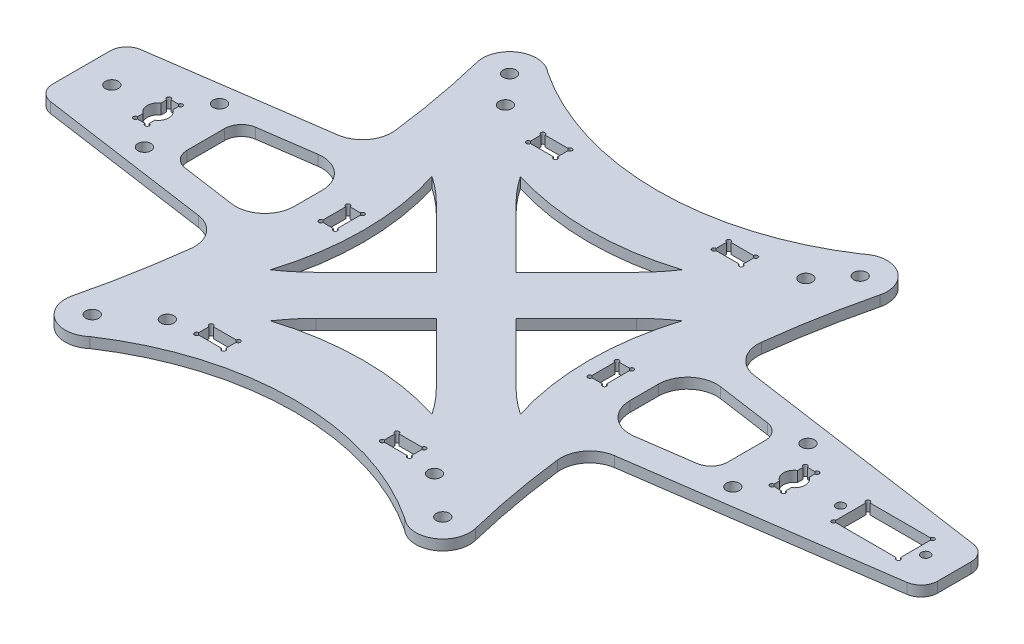
from build123d import *

# Parameters (mm, degrees)
SKETCH_1_R             = 1.55
SKETCH_1_R_2           = 1.05
SKETCH_1_W             = 6.5
SKETCH_1_H             = 3.5
SKETCH_1_W_2           = 3.5
SKETCH_1_H_2           = 6.5
SKETCH_1_W_3           = 15.5
SKETCH_1_H_3           = 8.2
EXTRUDE_1_DEPTH        = 2.5
FILLET_1_R             = 4
FILLET_2_R             = 7
SKETCH_2_R             = 0.5
CUT_EXTRUDE_4968_DEPTH = 128.770204339


with BuildPart() as part:
    # 草图1 → 凸台-拉伸1 (new body)
    with BuildSketch(Plane(origin=(0, 0, 0), x_dir=(1, 0, 0), z_dir=(0, 1, 0))):
        with BuildLine():
            Line((114.591143215, 7.468307572), (114.591143215, -7.468307572))
            Line((114.591143215, -7.468307572), (43.193640968, -17.646273029))
            ThreePointArc((43.193640968, -17.646273029), (45.143245402, -33.15226541), (48.27557779, -48.463217404))
            ThreePointArc((48.27557779, -48.463217404), (45.335063646, -55.533708325), (37.709796983, -54.831018053))
            ThreePointArc((37.709796983, -54.831018053), (0, -43.436211003), (-37.709796983, -54.831018053))
            ThreePointArc((-37.709796983, -54.831018053), (-45.335063646, -55.533708325), (-48.27557779, -48.463217404))
            ThreePointArc((-48.27557779, -48.463217404), (-45.143245402, -33.15226541), (-43.193640968, -17.646273029))
            Line((-43.193640968, -17.646273029), (-94.579518436, -10.321035179))
            Line((-94.579518436, -10.321035179), (-94.579518436, 10.321035179))
            Line((-94.579518436, 10.321035179), (-43.193640968, 17.646273029))
            ThreePointArc((-43.193640968, 17.646273029), (-45.143245402, 33.15226541), (-48.27557779, 48.463217404))
            ThreePointArc((-48.27557779, 48.463217404), (-45.335063646, 55.533708325), (-37.709796983, 54.831018053))
            ThreePointArc((-37.709796983, 54.831018053), (0, 43.436211003), (37.709796983, 54.831018053))
            ThreePointArc((37.709796983, 54.831018053), (45.335063646, 55.533708325), (48.27557779, 48.463217404))
            ThreePointArc((48.27557779, 48.463217404), (45.143245402, 33.15226541), (43.193640968, 17.646273029))
            Line((43.193640968, 17.646273029), (114.591143215, 7.468307572))
        make_face()
        with Locations((-36, 43)):
            Circle(SKETCH_1_R, mode=Mode.SUBTRACT)
        with Locations((-32, -42)):
            Circle(SKETCH_1_R, mode=Mode.SUBTRACT)
        with Locations((32, -42)):
            Circle(SKETCH_1_R, mode=Mode.SUBTRACT)
        with Locations((36, 43)):
            Circle(SKETCH_1_R, mode=Mode.SUBTRACT)
        with Locations((42, 50)):
            Circle(SKETCH_1_R, mode=Mode.SUBTRACT)
        with Locations((42, -50)):
            Circle(SKETCH_1_R, mode=Mode.SUBTRACT)
        with Locations((-42, -50)):
            Circle(SKETCH_1_R, mode=Mode.SUBTRACT)
        with Locations((-42, 50)):
            Circle(SKETCH_1_R, mode=Mode.SUBTRACT)
        with Locations((107.7, 0)):
            Circle(SKETCH_1_R_2, mode=Mode.SUBTRACT)
        with Locations((87.3, 0)):
            Circle(SKETCH_1_R_2, mode=Mode.SUBTRACT)
        with Locations((70.5, 9)):
            Circle(SKETCH_1_R, mode=Mode.SUBTRACT)
        with Locations((70.5, -9)):
            Circle(SKETCH_1_R, mode=Mode.SUBTRACT)
        with Locations((-70.5, -9)):
            Circle(SKETCH_1_R, mode=Mode.SUBTRACT)
        with Locations((-70.5, 9)):
            Circle(SKETCH_1_R, mode=Mode.SUBTRACT)
        with Locations((-87.3, 0)):
            Circle(SKETCH_1_R, mode=Mode.SUBTRACT)
        with Locations((-22.25, 39.75)):
            Rectangle(SKETCH_1_W, SKETCH_1_H, mode=Mode.SUBTRACT)
        with Locations((-32.25, 0)):
            Rectangle(SKETCH_1_W_2, SKETCH_1_H_2, mode=Mode.SUBTRACT)
        with Locations((-22.25, -39.75)):
            Rectangle(SKETCH_1_W, SKETCH_1_H, mode=Mode.SUBTRACT)
        with Locations((22.25, 39.75)):
            Rectangle(SKETCH_1_W, SKETCH_1_H, mode=Mode.SUBTRACT)
        with Locations((22.25, -39.75)):
            Rectangle(SKETCH_1_W, SKETCH_1_H, mode=Mode.SUBTRACT)
        with Locations((32.25, 0)):
            Rectangle(SKETCH_1_W_2, SKETCH_1_H_2, mode=Mode.SUBTRACT)
        with BuildLine():
            Line((77.65, -2.151778405), (77.65, -4))
            Line((77.65, -4), (74.85, -4))
            Line((74.85, -4), (74.85, -2.176778405))
            ThreePointArc((74.85, -2.176778405), (73.652957971, 0), (74.85, 2.176778405))
            Line((74.85, 2.176778405), (74.85, 4))
            Line((74.85, 4), (77.65, 4))
            Line((77.65, 4), (77.65, 2.151778405))
            ThreePointArc((77.65, 2.151778405), (78.8083942, 0), (77.65, -2.151778405))
        make_face(mode=Mode.SUBTRACT)
        with Locations((97.5, 0)):
            Rectangle(SKETCH_1_W_3, SKETCH_1_H_3, mode=Mode.SUBTRACT)
        with BuildLine():
            Line((-74.85, -2.176778405), (-74.85, -4))
            Line((-74.85, -4), (-77.65, -4))
            Line((-77.65, -4), (-77.65, -2.151778405))
            ThreePointArc((-77.65, -2.151778405), (-78.8083942, 0), (-77.65, 2.151778405))
            Line((-77.65, 2.151778405), (-77.65, 4))
            Line((-77.65, 4), (-74.85, 4))
            Line((-74.85, 4), (-74.85, 2.176778405))
            ThreePointArc((-74.85, 2.176778405), (-73.652957971, 0), (-74.85, -2.176778405))
        make_face(mode=Mode.SUBTRACT)
        with BuildLine():
            Line((-23.978041684, 14.429581723), (-9.54845996, 0))
            Line((-9.54845996, 0), (-23.978041684, -14.429581723))
            ThreePointArc((-23.978041684, -14.429581723), (-26.851664039, -17.042325553), (-29.960234119, -19.370614155))
            ThreePointArc((-29.960234119, -19.370614155), (-27.006361348, 0), (-29.960234119, 19.370614155))
            ThreePointArc((-29.960234119, 19.370614155), (-26.851664039, 17.042325553), (-23.978041684, 14.429581723))
        make_face(mode=Mode.SUBTRACT)
        with BuildLine():
            Line((14.429581723, 23.978041684), (0, 9.54845996))
            Line((0, 9.54845996), (-14.429581723, 23.978041684))
            ThreePointArc((-14.429581723, 23.978041684), (-17.042325553, 26.851664039), (-19.370614155, 29.960234119))
            ThreePointArc((-19.370614155, 29.960234119), (0, 27.006361348), (19.370614155, 29.960234119))
            ThreePointArc((19.370614155, 29.960234119), (17.042325553, 26.851664039), (14.429581723, 23.978041684))
        make_face(mode=Mode.SUBTRACT)
        with BuildLine():
            Line((23.978041684, -14.429581723), (9.54845996, 0))
            Line((9.54845996, 0), (23.978041684, 14.429581723))
            ThreePointArc((23.978041684, 14.429581723), (26.851664039, 17.042325553), (29.960234119, 19.370614155))
            ThreePointArc((29.960234119, 19.370614155), (27.006361348, 0), (29.960234119, -19.370614155))
            ThreePointArc((29.960234119, -19.370614155), (26.851664039, -17.042325553), (23.978041684, -14.429581723))
        make_face(mode=Mode.SUBTRACT)
        with BuildLine():
            Line((-14.429581723, -23.978041684), (0, -9.54845996))
            Line((0, -9.54845996), (14.429581723, -23.978041684))
            ThreePointArc((14.429581723, -23.978041684), (17.042325553, -26.851664039), (19.370614155, -29.960234119))
            ThreePointArc((19.370614155, -29.960234119), (0, -27.006361348), (-19.370614155, -29.960234119))
            ThreePointArc((-19.370614155, -29.960234119), (-17.042325553, -26.851664039), (-14.429581723, -23.978041684))
        make_face(mode=Mode.SUBTRACT)
        Polygon((-64.75, -7.957119899), (-64.75, 7.957119899), (-40.25, 11.449681205), (-40.25, -11.449681205), align=None, mode=Mode.SUBTRACT)
        Polygon((64.75, 7.957119899), (40.25, 11.449681205), (40.25, -11.449681205), (64.75, -7.957119899), align=None, mode=Mode.SUBTRACT)
    extrude(amount=EXTRUDE_1_DEPTH)

    # 圆角1
    fillet_1_edges = [part.edges().sort_by_distance(p)[0] for p in [
        (114.591143215, 1.25, -7.468307572),
        (114.591143215, 1.25, 7.468307572),
        (-94.579518436, 1.25, 10.321035179),
        (-94.579518436, 1.25, -10.321035179),
        (-64.75, 1.25, 7.957119899),
        (-64.75, 1.25, -7.957119899),
        (64.75, 1.25, 7.957119899),
        (64.75, 1.25, -7.957119899),
    ]]
    fillet(fillet_1_edges, radius=FILLET_1_R)

    # 圆角2
    fillet_2_edges = [part.edges().sort_by_distance(p)[0] for p in [
        (43.193640968, 1.25, -17.646273029),
        (43.193640968, 1.25, 17.646273029),
        (-43.193640968, 1.25, 17.646273029),
        (-43.193640968, 1.25, -17.646273029),
        (40.25, 1.25, 11.449681205),
        (40.25, 1.25, -11.449681205),
        (-40.25, 1.25, 11.449681205),
        (-40.25, 1.25, -11.449681205),
    ]]
    fillet(fillet_2_edges, radius=FILLET_2_R)

    # 草图2 → Cut-Extrude 4968 (cut, through all)
    with BuildSketch(Plane(origin=(0, 2.5, 0), x_dir=(1, 0, 0), z_dir=(0, 1, 0))):
        with Locations((-77.65, 4)):
            Circle(SKETCH_2_R)
        with Locations((-74.85, 4)):
            Circle(SKETCH_2_R)
        with Locations((-77.65, -4)):
            Circle(SKETCH_2_R)
        with Locations((-74.85, -4)):
            Circle(SKETCH_2_R)
        with Locations((-25.5, 41.5)):
            Circle(SKETCH_2_R)
        with Locations((-19, 41.5)):
            Circle(SKETCH_2_R)
        with Locations((-25.5, 38)):
            Circle(SKETCH_2_R)
        with Locations((-19, 38)):
            Circle(SKETCH_2_R)
        with Locations((-34, 3.25)):
            Circle(SKETCH_2_R)
        with Locations((-30.5, 3.25)):
            Circle(SKETCH_2_R)
        with Locations((-34, -3.25)):
            Circle(SKETCH_2_R)
        with Locations((-30.5, -3.25)):
            Circle(SKETCH_2_R)
        with Locations((-25.5, -38)):
            Circle(SKETCH_2_R)
        with Locations((-19, -38)):
            Circle(SKETCH_2_R)
        with Locations((-25.5, -41.5)):
            Circle(SKETCH_2_R)
        with Locations((-19, -41.5)):
            Circle(SKETCH_2_R)
        with Locations((19, -41.5)):
            Circle(SKETCH_2_R)
        with Locations((25.5, -41.5)):
            Circle(SKETCH_2_R)
        with Locations((19, -38)):
            Circle(SKETCH_2_R)
        with Locations((25.5, -38)):
            Circle(SKETCH_2_R)
        with Locations((30.5, -3.25)):
            Circle(SKETCH_2_R)
        with Locations((34, -3.25)):
            Circle(SKETCH_2_R)
        with Locations((30.5, 3.25)):
            Circle(SKETCH_2_R)
        with Locations((34, 3.25)):
            Circle(SKETCH_2_R)
        with Locations((19, 38)):
            Circle(SKETCH_2_R)
        with Locations((25.5, 38)):
            Circle(SKETCH_2_R)
        with Locations((19, 41.5)):
            Circle(SKETCH_2_R)
        with Locations((25.5, 41.5)):
            Circle(SKETCH_2_R)
        with Locations((74.85, -4)):
            Circle(SKETCH_2_R)
        with Locations((77.65, -4)):
            Circle(SKETCH_2_R)
        with Locations((74.85, 4)):
            Circle(SKETCH_2_R)
        with Locations((77.65, 4)):
            Circle(SKETCH_2_R)
        with Locations((89.75, 4.1)):
            Circle(SKETCH_2_R)
        with Locations((105.25, 4.1)):
            Circle(SKETCH_2_R)
        with Locations((89.75, -4.1)):
            Circle(SKETCH_2_R)
        with Locations((105.25, -4.1)):
            Circle(SKETCH_2_R)
    extrude(amount=-CUT_EXTRUDE_4968_DEPTH, mode=Mode.SUBTRACT)


solid = part.part
